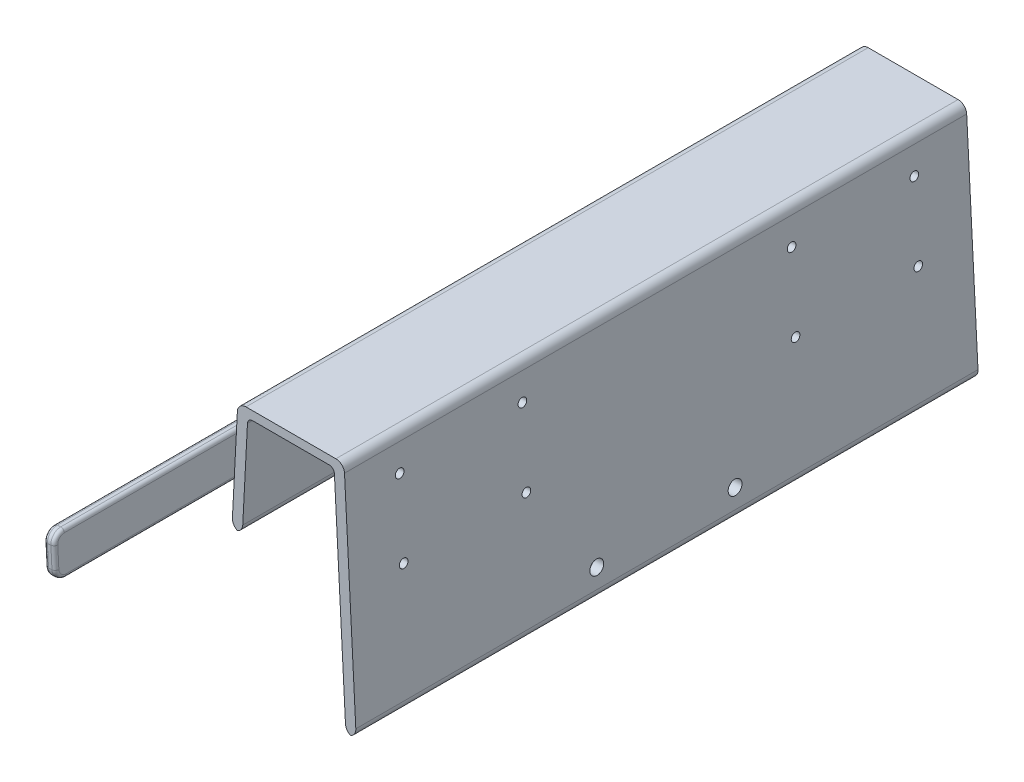
from build123d import *

# Parameters (mm, degrees)
BOSS_EXTRUDE1_DEPTH = 180
HOLDER_CUT_REACH    = 188.811
SKETCH2_R           = 1.25
CUT_EXTRUDE2_REACH  = 188.811
SKETCH4_R           = 2
FILLET2_R           = 1.5
FILLET3_R           = 2.5
SKETCH5_W           = 180
SKETCH5_H           = 12
SKETCH5_R           = 2
BOSS_EXTRUDE2_DEPTH = 3
FILLET1_R           = 3
FILLET4_R           = 2.5
FILLET5_R           = 2.5
FILLET6_R           = 1


with BuildPart() as part:
    # Sketch1 → Boss-Extrude1 (new body)
    with BuildSketch(Plane.XY):
        Polygon((0, 0), (1.570078687, 29.958886043), (26.570078687, 29.958886043), (29.971915843, -34.952033716), (32.976032881, -34.952033716), (29.443176277, 32.458886043), (-1.303018902, 32.458886043), (-3.004117038, 0), align=None)
    extrude(amount=-BOSS_EXTRUDE1_DEPTH)

    # Sketch2 → Holder cut (cut, up to next)
    with BuildSketch(Plane(origin=(31.058968616, 1.627731572, 0), x_dir=(0, 0, -1), z_dir=(0.998629534754574, 0.05233595624294041, 0)), mode=Mode.PRIVATE) as holder_cut_sk1:
        with Locations(Location((128.94, 20.873465482, 0), (0, 0, 90))):
            Circle(SKETCH2_R)
    holder_cut_tool1 = extrude(holder_cut_sk1.sketch, amount=-HOLDER_CUT_REACH, mode=Mode.PRIVATE) & part.part
    # Sketch2 → Holder cut (cut, up to next)
    with BuildSketch(Plane(origin=(31.058968616, 1.627731572, 0), x_dir=(0, 0, -1), z_dir=(0.998629534754574, 0.05233595624294041, 0)), mode=Mode.PRIVATE) as holder_cut_sk2:
        with Locations(Location((164.44, 20.873465482, 0), (0, 0, 90))):
            Circle(SKETCH2_R)
    holder_cut_tool2 = extrude(holder_cut_sk2.sketch, amount=-HOLDER_CUT_REACH, mode=Mode.PRIVATE) & part.part
    # Sketch2 → Holder cut (cut, up to next)
    with BuildSketch(Plane(origin=(31.058968616, 1.627731572, 0), x_dir=(0, 0, -1), z_dir=(0.998629534754574, 0.05233595624294041, 0)), mode=Mode.PRIVATE) as holder_cut_sk3:
        with Locations(Location((128.94, -1.126534518, 0), (0, 0, 90))):
            Circle(SKETCH2_R)
    holder_cut_tool3 = extrude(holder_cut_sk3.sketch, amount=-HOLDER_CUT_REACH, mode=Mode.PRIVATE) & part.part
    # Sketch2 → Holder cut (cut, up to next)
    with BuildSketch(Plane(origin=(31.058968616, 1.627731572, 0), x_dir=(0, 0, -1), z_dir=(0.998629534754574, 0.05233595624294041, 0)), mode=Mode.PRIVATE) as holder_cut_sk4:
        with Locations(Location((164.44, -1.126534518, 0), (0, 0, 90))):
            Circle(SKETCH2_R)
    holder_cut_tool4 = extrude(holder_cut_sk4.sketch, amount=-HOLDER_CUT_REACH, mode=Mode.PRIVATE) & part.part
    # Sketch2 → Holder cut (cut, up to next)
    with BuildSketch(Plane(origin=(31.058968616, 1.627731572, 0), x_dir=(0, 0, -1), z_dir=(0.998629534754574, 0.05233595624294041, 0)), mode=Mode.PRIVATE) as holder_cut_sk5:
        with Locations(Location((51.06, -1.126534518, 0), (0, 0, 270))):
            Circle(SKETCH2_R)
    holder_cut_tool5 = extrude(holder_cut_sk5.sketch, amount=-HOLDER_CUT_REACH, mode=Mode.PRIVATE) & part.part
    # Sketch2 → Holder cut (cut, up to next)
    with BuildSketch(Plane(origin=(31.058968616, 1.627731572, 0), x_dir=(0, 0, -1), z_dir=(0.998629534754574, 0.05233595624294041, 0)), mode=Mode.PRIVATE) as holder_cut_sk6:
        with Locations(Location((15.56, -1.126534518, 0), (0, 0, 270))):
            Circle(SKETCH2_R)
    holder_cut_tool6 = extrude(holder_cut_sk6.sketch, amount=-HOLDER_CUT_REACH, mode=Mode.PRIVATE) & part.part
    # Sketch2 → Holder cut (cut, up to next)
    with BuildSketch(Plane(origin=(31.058968616, 1.627731572, 0), x_dir=(0, 0, -1), z_dir=(0.998629534754574, 0.05233595624294041, 0)), mode=Mode.PRIVATE) as holder_cut_sk7:
        with Locations(Location((15.56, 20.873465482, 0), (0, 0, 270))):
            Circle(SKETCH2_R)
    holder_cut_tool7 = extrude(holder_cut_sk7.sketch, amount=-HOLDER_CUT_REACH, mode=Mode.PRIVATE) & part.part
    # Sketch2 → Holder cut (cut, up to next)
    with BuildSketch(Plane(origin=(31.058968616, 1.627731572, 0), x_dir=(0, 0, -1), z_dir=(0.998629534754574, 0.05233595624294041, 0)), mode=Mode.PRIVATE) as holder_cut_sk8:
        with Locations(Location((51.06, 20.873465482, 0), (0, 0, 270))):
            Circle(SKETCH2_R)
    holder_cut_tool8 = extrude(holder_cut_sk8.sketch, amount=-HOLDER_CUT_REACH, mode=Mode.PRIVATE) & part.part
    add(holder_cut_tool1.solids().sort_by_distance((29.966536, 22.472591, -128.94))[0], mode=Mode.SUBTRACT)
    add(holder_cut_tool2.solids().sort_by_distance((29.966536, 22.472591, -164.44))[0], mode=Mode.SUBTRACT)
    add(holder_cut_tool3.solids().sort_by_distance((31.117927, 0.502741, -128.94))[0], mode=Mode.SUBTRACT)
    add(holder_cut_tool4.solids().sort_by_distance((31.117927, 0.502741, -164.44))[0], mode=Mode.SUBTRACT)
    add(holder_cut_tool5.solids().sort_by_distance((31.117927, 0.502741, -51.06))[0], mode=Mode.SUBTRACT)
    add(holder_cut_tool6.solids().sort_by_distance((31.117927, 0.502741, -15.56))[0], mode=Mode.SUBTRACT)
    add(holder_cut_tool7.solids().sort_by_distance((29.966536, 22.472591, -15.56))[0], mode=Mode.SUBTRACT)
    add(holder_cut_tool8.solids().sort_by_distance((29.966536, 22.472591, -51.06))[0], mode=Mode.SUBTRACT)

    # Sketch4 → Cut-Extrude2 (cut, up to next)
    with BuildSketch(Plane(origin=(31.058968616, 1.627731572, 0), x_dir=(0, 0, -1), z_dir=(0.998629534754574, 0.05233595624294041, 0)), mode=Mode.PRIVATE) as cut_extrude2_sk1:
        with Locations(Location((110, -28.629965383, 0), (0, 0, 90))):
            Circle(SKETCH4_R)
    cut_extrude2_tool1 = extrude(cut_extrude2_sk1.sketch, amount=-CUT_EXTRUDE2_REACH, mode=Mode.PRIVATE) & part.part
    cut_extrude2 = cut_extrude2_tool1.solids().sort_by_distance((32.557345, -26.962997, -110))[0]
    add(cut_extrude2, mode=Mode.SUBTRACT)

    # Mirror1: Cut-Extrude2 across plane
    add(cut_extrude2.mirror(Plane.XY.offset(-90)), mode=Mode.SUBTRACT)

    # Fillet2
    fillet2_edges = [part.edges().sort_by_distance(p)[0] for p in [
        (26.570078687, 29.958886043, -90),
        (1.570078687, 29.958886043, -90),
    ]]
    fillet(fillet2_edges, radius=FILLET2_R)

    # Fillet3
    # the kernel refuses this fillet: 2.5 mm, written as the material it takes off along each edge
    with BuildSketch(Plane(origin=(-3.004117038, 0, 6.586125783), x_dir=(1, 0, 0), z_dir=(0, 0, -1))) as fillet3_piece_1:
        with BuildLine():
            CenterArc((FILLET3_R * 1.05378012528, -FILLET3_R), FILLET3_R, 90, 93)
            Line((FILLET3_R * 0.0551505905264, -FILLET3_R * 1.05233595624), (0, 0))
            Line((0, 0), (FILLET3_R * 1.05378012528, 0))
        make_face()
    extrude(amount=193.172251566, mode=Mode.SUBTRACT)
    with BuildSketch(Plane(origin=(0, 0, 5.931028542), x_dir=(0.05233595624294039, 0.9986295347545739, 0), z_dir=(0, 0, -1))) as fillet3_piece_2:
        with BuildLine():
            CenterArc((FILLET3_R * 0.948964566715, -FILLET3_R), FILLET3_R, 90, 87)
            Line((-FILLET3_R * 0.0496649680397, -FILLET3_R * 0.947664043757), (0, 0))
            Line((0, 0), (FILLET3_R * 0.948964566715, 0))
        make_face()
    extrude(amount=191.862057084, mode=Mode.SUBTRACT)

    # Fillet4
    # the kernel refuses this fillet: 2.5 mm, written as the material it takes off along each edge
    with BuildSketch(Plane(origin=(32.976032881, -34.952033716, 6.586125783), x_dir=(-0.05233595624293978, 0.998629534754574, 0), z_dir=(0, 0, -1))) as fillet4_piece_1:
        with BuildLine():
            CenterArc((FILLET4_R * 1.05378012528, -FILLET4_R), FILLET4_R, 90, 93)
            Line((FILLET4_R * 0.0551505905264, -FILLET4_R * 1.05233595624), (0, 0))
            Line((0, 0), (FILLET4_R * 1.05378012528, 0))
        make_face()
    extrude(amount=193.172251566, mode=Mode.SUBTRACT)
    with BuildSketch(Plane(origin=(29.971915843, -34.952033716, 5.931028542), x_dir=(1, 0, 0), z_dir=(0, 0, -1))) as fillet4_piece_2:
        with BuildLine():
            CenterArc((FILLET4_R * 0.948964566715, -FILLET4_R), FILLET4_R, 90, 87)
            Line((-FILLET4_R * 0.0496649680397, -FILLET4_R * 0.947664043757), (0, 0))
            Line((0, 0), (FILLET4_R * 0.948964566715, 0))
        make_face()
    extrude(amount=191.862057084, mode=Mode.SUBTRACT)

    # Fillet5
    fillet5_edges = [part.edges().sort_by_distance(p)[0] for p in [
        (-1.303018902, 32.458886043, -90),
        (29.443176277, 32.458886043, -90),
    ]]
    fillet(fillet5_edges, radius=FILLET5_R)


with BuildPart() as body_2:
    # Sketch5 → Boss-Extrude2 (new body)
    with BuildSketch(Plane(origin=(-58.817689512, -3.08250449, 0), x_dir=(0, 0, -1), z_dir=(0.998629534754574, 0.05233595624294041, 0))):
        with Locations((90, -30.472742045)):
            Rectangle(SKETCH5_W, SKETCH5_H)
        with Locations(Location((110, -28.629965383, 0), (0, 0, 90))):
            Circle(SKETCH5_R, mode=Mode.SUBTRACT)
        with Locations(Location((70, -28.629965383, 0), (0, 0, 90))):
            Circle(SKETCH5_R, mode=Mode.SUBTRACT)
    extrude(amount=BOSS_EXTRUDE2_DEPTH)

    # Fillet1
    fillet1_edges = [body_2.edges().sort_by_distance(p)[0] for p in [
        (-55.410909378, -39.426757975, 0),
        (-56.038940853, -27.443203558, 0),
        (-56.038940853, -27.443203558, -180),
        (-55.410909378, -39.426757975, -180),
    ]]
    fillet(fillet1_edges, radius=FILLET1_R)

    # Fillet6
    fillet6_edges = [body_2.edges().sort_by_distance(p)[0] for p in [
        (-57.222869418, -33.513484701, -180),
        (-54.226980814, -33.356476832, -180),
        (-56.908853681, -39.50526191, -90),
        (-57.222869418, -33.513484701, 0),
        (-57.536885155, -27.521707492, -90),
        (-56.954840221, -38.627786453, -0.878679656),
        (-57.490898615, -28.399182949, -0.878679656),
        (-57.490898615, -28.399182949, -179.121320344),
        (-56.954840221, -38.627786453, -179.121320344),
        (-53.912965076, -39.348254041, -90),
        (-54.540996551, -27.364699624, -90),
        (-54.226980814, -33.356476832, 0),
        (-53.958951616, -38.470778584, -0.878679656),
        (-54.495010011, -28.24217508, -0.878679656),
        (-54.495010011, -28.24217508, -179.121320344),
        (-53.958951616, -38.470778584, -179.121320344),
    ]]
    fillet(fillet6_edges, radius=FILLET6_R)


solid = Compound([part.part, body_2.part])
